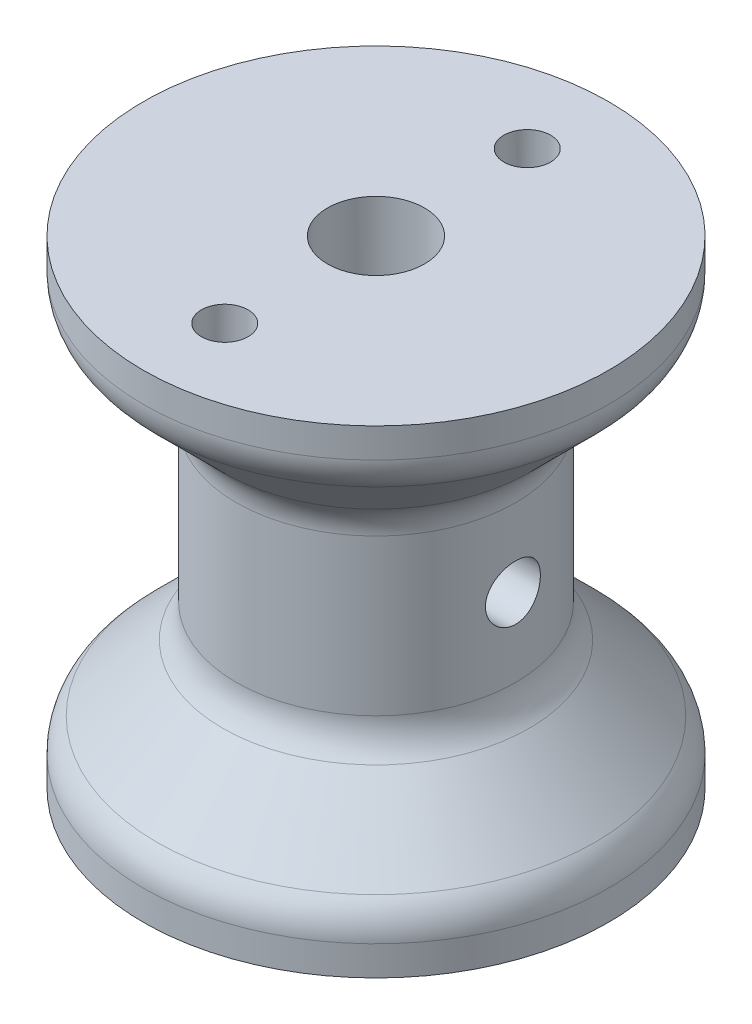
from build123d import *

# Parameters (mm, degrees)
SKETCH1_R                 = 12.7
BOSS_EXTRUDE1_DEPTH       = 36
F_5_0MM_DOWEL_HOLE1_D     = 5.3
BOSS_EXTRUDE2_START       = -4.953
BOSS_EXTRUDE2_DEPTH       = 2.286
CIRPATTERN3_COUNT         = 33
CIRPATTERN3_ANGLE         = 348.48
CIRPATTERN3_START         = -4.953
CIRPATTERN3_COPY_1_DEPTH  = 2.286
CIRPATTERN3_COPY_2_DEPTH  = 2.286
CIRPATTERN3_COPY_3_DEPTH  = 2.286
CIRPATTERN3_COPY_4_DEPTH  = 2.286
CIRPATTERN3_COPY_5_DEPTH  = 2.286
CIRPATTERN3_COPY_6_DEPTH  = 2.286
CIRPATTERN3_COPY_7_DEPTH  = 2.286
CIRPATTERN3_COPY_8_DEPTH  = 2.286
CIRPATTERN3_COPY_9_DEPTH  = 2.286
CIRPATTERN3_COPY_10_DEPTH = 2.286
CIRPATTERN3_COPY_11_DEPTH = 2.286
CIRPATTERN3_COPY_12_DEPTH = 2.286
CIRPATTERN3_COPY_13_DEPTH = 2.286
CIRPATTERN3_COPY_14_DEPTH = 2.286
CIRPATTERN3_COPY_15_DEPTH = 2.286
CIRPATTERN3_COPY_16_DEPTH = 2.286
CIRPATTERN3_COPY_17_DEPTH = 2.286
CIRPATTERN3_COPY_18_DEPTH = 2.286
CIRPATTERN3_COPY_19_DEPTH = 2.286
CIRPATTERN3_COPY_20_DEPTH = 2.286
CIRPATTERN3_COPY_21_DEPTH = 2.286
CIRPATTERN3_COPY_22_DEPTH = 2.286
CIRPATTERN3_COPY_23_DEPTH = 2.286
CIRPATTERN3_COPY_24_DEPTH = 2.286
CIRPATTERN3_COPY_25_DEPTH = 2.286
CIRPATTERN3_COPY_26_DEPTH = 2.286
CIRPATTERN3_COPY_27_DEPTH = 2.286
CIRPATTERN3_COPY_28_DEPTH = 2.286
CIRPATTERN3_COPY_29_DEPTH = 2.286
CIRPATTERN3_COPY_30_DEPTH = 2.286
CIRPATTERN3_COPY_31_DEPTH = 2.286
CIRPATTERN3_COPY_32_DEPTH = 2.286
SKETCH7_W                 = 5.08
SKETCH7_H                 = 20.76
CHAMFER1_SIZE             = 5.08
SKETCH10_W                = 1.5
SKETCH10_H                = 14.726283714
FILLET2_R                 = 1.27
M3X0_5_TAPPED_HOLE2_D     = 2.55
M3X0_5_TAPPED_HOLE2_DEPTH = 9.906
M3X0_5_TAPPED_HOLE2_TIP   = 1.06985203
M3X0_5_TAPPED_HOLE1_D     = 2.5
M3X0_5_TAPPED_HOLE1_DEPTH = 9.906
M3X0_5_TAPPED_HOLE1_TIP   = 1.048874539
INTERSECT1_OUTLINE_R      = 2.65
INTERSECT1_OUTLINE_R_2    = 1.25
INTERSECT1_DEPTH          = 4.953
INTERSECT1_START          = 31.047
INTERSECT1_2_OUTLINE_R    = 1.275
INTERSECT1_2_OUTLINE_R_2  = 2.65
INTERSECT1_2_DEPTH        = 4.953


with BuildPart() as part:
    # Sketch1 → Boss-Extrude1 (new body)
    with BuildSketch(Plane(origin=(0, 0, 0), x_dir=(1, 0, 0), z_dir=(0, 1, 0))):
        with Locations(Location((0, 0, 0), (0, 0, 270))):
            Circle(SKETCH1_R)
    extrude(amount=BOSS_EXTRUDE1_DEPTH)

    # Ø5.0mm Dowel Hole1 (through all)
    with Locations(Plane(origin=(0, 36, 0), x_dir=(1, 0, 0), z_dir=(0, 1, 0))):
        with Locations((0, 0)):
            Hole(F_5_0MM_DOWEL_HOLE1_D / 2)

    # Sketch4 → Boss-Extrude2 (add)
    with BuildSketch(Plane(origin=(0, 36, 0), x_dir=(1, 0, 0), z_dir=(0, 1, 0)).offset(BOSS_EXTRUDE2_START)):
        with BuildLine():
            Line((14.726283714, 0.381), (12.694283714, 0.381))
            ThreePointArc((12.694283714, 0.381), (12.698570848, 0.19052144), (12.7, 0))
            ThreePointArc((12.7, 0), (12.698570848, -0.19052144), (12.694283714, -0.381))
            Line((12.694283714, -0.381), (14.726283714, -0.381))
            Line((14.726283714, -0.381), (14.726283714, 0.381))
        make_face()
    boss_extrude2 = extrude(amount=BOSS_EXTRUDE2_DEPTH)

    # Mirror4: Boss-Extrude2 across plane
    add(boss_extrude2.mirror(Plane.ZX.offset(18)))

    # CirPattern3: Boss-Extrude2 ×33 about axis
    cirpattern3_axis = Axis((0, 0, 0), (0, 1, 0))
    for i in range(1, CIRPATTERN3_COUNT):
        add(boss_extrude2.rotate(cirpattern3_axis, i * CIRPATTERN3_ANGLE / (CIRPATTERN3_COUNT - 1)))

    # CirPattern3 copy 1 sketch → CirPattern3 copy 1 (add)
    with BuildSketch(Plane(origin=(0, 0, 0), x_dir=(0.9819917011209965, 0, -0.18892405598412157), z_dir=(0, -1, 0)).offset(CIRPATTERN3_START)):
        with BuildLine():
            Line((14.726283714, -0.381), (12.694283714, -0.381))
            ThreePointArc((12.694283714, -0.381), (12.698570848, -0.19052144), (12.7, 0))
            ThreePointArc((12.7, 0), (12.698570848, 0.19052144), (12.694283714, 0.381))
            Line((12.694283714, 0.381), (14.726283714, 0.381))
            Line((14.726283714, 0.381), (14.726283714, -0.381))
        make_face()
    extrude(amount=CIRPATTERN3_COPY_1_DEPTH)

    # CirPattern3 copy 2 sketch → CirPattern3 copy 2 (add)
    with BuildSketch(Plane(origin=(0, 0, 0), x_dir=(0.928615402141017, 0, -0.37104371023705185), z_dir=(0, -1, 0)).offset(CIRPATTERN3_START)):
        with BuildLine():
            Line((14.726283714, -0.381), (12.694283714, -0.381))
            ThreePointArc((12.694283714, -0.381), (12.698570848, -0.19052144), (12.7, 0))
            ThreePointArc((12.7, 0), (12.698570848, 0.19052144), (12.694283714, 0.381))
            Line((12.694283714, 0.381), (14.726283714, 0.381))
            Line((14.726283714, 0.381), (14.726283714, -0.381))
        make_face()
    extrude(amount=CIRPATTERN3_COPY_2_DEPTH)

    # CirPattern3 copy 3 sketch → CirPattern3 copy 3 (add)
    with BuildSketch(Plane(origin=(0, 0, 0), x_dir=(0.8417935357502346, 0, -0.5397996324277357), z_dir=(0, -1, 0)).offset(CIRPATTERN3_START)):
        with BuildLine():
            Line((14.726283714, -0.381), (12.694283714, -0.381))
            ThreePointArc((12.694283714, -0.381), (12.698570848, -0.19052144), (12.7, 0))
            ThreePointArc((12.7, 0), (12.698570848, 0.19052144), (12.694283714, 0.381))
            Line((12.694283714, 0.381), (14.726283714, 0.381))
            Line((14.726283714, 0.381), (14.726283714, -0.381))
        make_face()
    extrude(amount=CIRPATTERN3_COPY_3_DEPTH)

    # CirPattern3 copy 4 sketch → CirPattern3 copy 4 (add)
    with BuildSketch(Plane(origin=(0, 0, 0), x_dir=(0.7246531301870455, 0, -0.6891138083873497), z_dir=(0, -1, 0)).offset(CIRPATTERN3_START)):
        with BuildLine():
            Line((14.726283714, -0.381), (12.694283714, -0.381))
            ThreePointArc((12.694283714, -0.381), (12.698570848, -0.19052144), (12.7, 0))
            ThreePointArc((12.7, 0), (12.698570848, 0.19052144), (12.694283714, 0.381))
            Line((12.694283714, 0.381), (14.726283714, 0.381))
            Line((14.726283714, 0.381), (14.726283714, -0.381))
        make_face()
    extrude(amount=CIRPATTERN3_COPY_4_DEPTH)

    # CirPattern3 copy 5 sketch → CirPattern3 copy 5 (add)
    with BuildSketch(Plane(origin=(0, 0, 0), x_dir=(0.5814131843198288, 0, -0.8136084495007884), z_dir=(0, -1, 0)).offset(CIRPATTERN3_START)):
        with BuildLine():
            Line((14.726283714, -0.381), (12.694283714, -0.381))
            ThreePointArc((12.694283714, -0.381), (12.698570848, -0.19052144), (12.7, 0))
            ThreePointArc((12.7, 0), (12.698570848, 0.19052144), (12.694283714, 0.381))
            Line((12.694283714, 0.381), (14.726283714, 0.381))
            Line((14.726283714, 0.381), (14.726283714, -0.381))
        make_face()
    extrude(amount=CIRPATTERN3_COPY_5_DEPTH)

    # CirPattern3 copy 6 sketch → CirPattern3 copy 6 (add)
    with BuildSketch(Plane(origin=(0, 0, 0), x_dir=(0.417232713661763, 0, -0.9087996823560411), z_dir=(0, -1, 0)).offset(CIRPATTERN3_START)):
        with BuildLine():
            Line((14.726283714, -0.381), (12.694283714, -0.381))
            ThreePointArc((12.694283714, -0.381), (12.698570848, -0.19052144), (12.7, 0))
            ThreePointArc((12.7, 0), (12.698570848, 0.19052144), (12.694283714, 0.381))
            Line((12.694283714, 0.381), (14.726283714, 0.381))
            Line((14.726283714, 0.381), (14.726283714, -0.381))
        make_face()
    extrude(amount=CIRPATTERN3_COPY_6_DEPTH)

    # CirPattern3 copy 7 sketch → CirPattern3 copy 7 (add)
    with BuildSketch(Plane(origin=(0, 0, 0), x_dir=(0.2380249401842595, 0, -0.971259042609272), z_dir=(0, -1, 0)).offset(CIRPATTERN3_START)):
        with BuildLine():
            Line((14.726283714, -0.381), (12.694283714, -0.381))
            ThreePointArc((12.694283714, -0.381), (12.698570848, -0.19052144), (12.7, 0))
            ThreePointArc((12.7, 0), (12.698570848, 0.19052144), (12.694283714, 0.381))
            Line((12.694283714, 0.381), (14.726283714, 0.381))
            Line((14.726283714, 0.381), (14.726283714, -0.381))
        make_face()
    extrude(amount=CIRPATTERN3_COPY_7_DEPTH)

    # CirPattern3 copy 8 sketch → CirPattern3 copy 8 (add)
    with BuildSketch(Plane(origin=(0, 0, 0), x_dir=(0.05024431817976605, 0, -0.9987369566060177), z_dir=(0, -1, 0)).offset(CIRPATTERN3_START)):
        with BuildLine():
            Line((14.726283714, -0.381), (12.694283714, -0.381))
            ThreePointArc((12.694283714, -0.381), (12.698570848, -0.19052144), (12.7, 0))
            ThreePointArc((12.7, 0), (12.698570848, 0.19052144), (12.694283714, 0.381))
            Line((12.694283714, 0.381), (14.726283714, 0.381))
            Line((14.726283714, 0.381), (14.726283714, -0.381))
        make_face()
    extrude(amount=CIRPATTERN3_COPY_8_DEPTH)

    # CirPattern3 copy 9 sketch → CirPattern3 copy 9 (add)
    with BuildSketch(Plane(origin=(0, 0, 0), x_dir=(-0.13934593322223357, 0, -0.9902437633706282), z_dir=(0, -1, 0)).offset(CIRPATTERN3_START)):
        with BuildLine():
            Line((14.726283714, -0.381), (12.694283714, -0.381))
            ThreePointArc((12.694283714, -0.381), (12.698570848, -0.19052144), (12.7, 0))
            ThreePointArc((12.7, 0), (12.698570848, 0.19052144), (12.694283714, 0.381))
            Line((12.694283714, 0.381), (14.726283714, 0.381))
            Line((14.726283714, 0.381), (14.726283714, -0.381))
        make_face()
    extrude(amount=CIRPATTERN3_COPY_9_DEPTH)

    # CirPattern3 copy 10 sketch → CirPattern3 copy 10 (add)
    with BuildSketch(Plane(origin=(0, 0, 0), x_dir=(-0.3239174181981537, 0, -0.9460853588275439), z_dir=(0, -1, 0)).offset(CIRPATTERN3_START)):
        with BuildLine():
            Line((14.726283714, -0.381), (12.694283714, -0.381))
            ThreePointArc((12.694283714, -0.381), (12.698570848, -0.19052144), (12.7, 0))
            ThreePointArc((12.7, 0), (12.698570848, 0.19052144), (12.694283714, 0.381))
            Line((12.694283714, 0.381), (14.726283714, 0.381))
            Line((14.726283714, 0.381), (14.726283714, -0.381))
        make_face()
    extrude(amount=CIRPATTERN3_COPY_10_DEPTH)

    # CirPattern3 copy 11 sketch → CirPattern3 copy 11 (add)
    with BuildSketch(Plane(origin=(0, 0, 0), x_dir=(-0.4968224998160187, 0, -0.8678521784708281), z_dir=(0, -1, 0)).offset(CIRPATTERN3_START)):
        with BuildLine():
            Line((14.726283714, -0.381), (12.694283714, -0.381))
            ThreePointArc((12.694283714, -0.381), (12.698570848, -0.19052144), (12.7, 0))
            ThreePointArc((12.7, 0), (12.698570848, 0.19052144), (12.694283714, 0.381))
            Line((12.694283714, 0.381), (14.726283714, 0.381))
            Line((14.726283714, 0.381), (14.726283714, -0.381))
        make_face()
    extrude(amount=CIRPATTERN3_COPY_11_DEPTH)

    # CirPattern3 copy 12 sketch → CirPattern3 copy 12 (add)
    with BuildSketch(Plane(origin=(0, 0, 0), x_dir=(-0.6518337253008826, 0, -0.7583619152887185), z_dir=(0, -1, 0)).offset(CIRPATTERN3_START)):
        with BuildLine():
            Line((14.726283714, -0.381), (12.694283714, -0.381))
            ThreePointArc((12.694283714, -0.381), (12.698570848, -0.19052144), (12.7, 0))
            ThreePointArc((12.7, 0), (12.698570848, 0.19052144), (12.694283714, 0.381))
            Line((12.694283714, 0.381), (14.726283714, 0.381))
            Line((14.726283714, 0.381), (14.726283714, -0.381))
        make_face()
    extrude(amount=CIRPATTERN3_COPY_12_DEPTH)

    # CirPattern3 copy 13 sketch → CirPattern3 copy 13 (add)
    with BuildSketch(Plane(origin=(0, 0, 0), x_dir=(-0.7833681176964816, 0, -0.6215580360486632), z_dir=(0, -1, 0)).offset(CIRPATTERN3_START)):
        with BuildLine():
            Line((14.726283714, -0.381), (12.694283714, -0.381))
            ThreePointArc((12.694283714, -0.381), (12.698570848, -0.19052144), (12.7, 0))
            ThreePointArc((12.7, 0), (12.698570848, 0.19052144), (12.694283714, 0.381))
            Line((12.694283714, 0.381), (14.726283714, 0.381))
            Line((14.726283714, 0.381), (14.726283714, -0.381))
        make_face()
    extrude(amount=CIRPATTERN3_COPY_13_DEPTH)

    # CirPattern3 copy 14 sketch → CirPattern3 copy 14 (add)
    with BuildSketch(Plane(origin=(0, 0, 0), x_dir=(-0.8866882557005594, 0, -0.46236775104098626), z_dir=(0, -1, 0)).offset(CIRPATTERN3_START)):
        with BuildLine():
            Line((14.726283714, -0.381), (12.694283714, -0.381))
            ThreePointArc((12.694283714, -0.381), (12.698570848, -0.19052144), (12.7, 0))
            ThreePointArc((12.7, 0), (12.698570848, 0.19052144), (12.694283714, 0.381))
            Line((12.694283714, 0.381), (14.726283714, 0.381))
            Line((14.726283714, 0.381), (14.726283714, -0.381))
        make_face()
    extrude(amount=CIRPATTERN3_COPY_14_DEPTH)

    # CirPattern3 copy 15 sketch → CirPattern3 copy 15 (add)
    with BuildSketch(Plane(origin=(0, 0, 0), x_dir=(-0.9580728994623211, 0, -0.2865245527277917), z_dir=(0, -1, 0)).offset(CIRPATTERN3_START)):
        with BuildLine():
            Line((14.726283714, -0.381), (12.694283714, -0.381))
            ThreePointArc((12.694283714, -0.381), (12.698570848, -0.19052144), (12.7, 0))
            ThreePointArc((12.7, 0), (12.698570848, 0.19052144), (12.694283714, 0.381))
            Line((12.694283714, 0.381), (14.726283714, 0.381))
            Line((14.726283714, 0.381), (14.726283714, -0.381))
        make_face()
    extrude(amount=CIRPATTERN3_COPY_15_DEPTH)

    # CirPattern3 copy 16 sketch → CirPattern3 copy 16 (add)
    with BuildSketch(Plane(origin=(0, 0, 0), x_dir=(-0.9949510169813008, 0, -0.1003617148512079), z_dir=(0, -1, 0)).offset(CIRPATTERN3_START)):
        with BuildLine():
            Line((14.726283714, -0.381), (12.694283714, -0.381))
            ThreePointArc((12.694283714, -0.381), (12.698570848, -0.19052144), (12.7, 0))
            ThreePointArc((12.7, 0), (12.698570848, 0.19052144), (12.694283714, 0.381))
            Line((12.694283714, 0.381), (14.726283714, 0.381))
            Line((14.726283714, 0.381), (14.726283714, -0.381))
        make_face()
    extrude(amount=CIRPATTERN3_COPY_16_DEPTH)

    # CirPattern3 copy 17 sketch → CirPattern3 copy 17 (add)
    with BuildSketch(Plane(origin=(0, 0, 0), x_dir=(-0.9959943839327452, 0, 0.08941581053947567), z_dir=(0, -1, 0)).offset(CIRPATTERN3_START)):
        with BuildLine():
            Line((14.726283714, -0.381), (12.694283714, -0.381))
            ThreePointArc((12.694283714, -0.381), (12.698570848, -0.19052144), (12.7, 0))
            ThreePointArc((12.7, 0), (12.698570848, 0.19052144), (12.694283714, 0.381))
            Line((12.694283714, 0.381), (14.726283714, 0.381))
            Line((14.726283714, 0.381), (14.726283714, -0.381))
        make_face()
    extrude(amount=CIRPATTERN3_COPY_17_DEPTH)

    # CirPattern3 copy 18 sketch → CirPattern3 copy 18 (add)
    with BuildSketch(Plane(origin=(0, 0, 0), x_dir=(-0.9611654217888497, 0, 0.27597288264875364), z_dir=(0, -1, 0)).offset(CIRPATTERN3_START)):
        with BuildLine():
            Line((14.726283714, -0.381), (12.694283714, -0.381))
            ThreePointArc((12.694283714, -0.381), (12.698570848, -0.19052144), (12.7, 0))
            ThreePointArc((12.7, 0), (12.698570848, 0.19052144), (12.694283714, 0.381))
            Line((12.694283714, 0.381), (14.726283714, 0.381))
            Line((14.726283714, 0.381), (14.726283714, -0.381))
        make_face()
    extrude(amount=CIRPATTERN3_COPY_18_DEPTH)

    # CirPattern3 copy 19 sketch → CirPattern3 copy 19 (add)
    with BuildSketch(Plane(origin=(0, 0, 0), x_dir=(-0.8917185512694802, 0, 0.45259035045155294), z_dir=(0, -1, 0)).offset(CIRPATTERN3_START)):
        with BuildLine():
            Line((14.726283714, -0.381), (12.694283714, -0.381))
            ThreePointArc((12.694283714, -0.381), (12.698570848, -0.19052144), (12.7, 0))
            ThreePointArc((12.7, 0), (12.698570848, 0.19052144), (12.694283714, 0.381))
            Line((12.694283714, 0.381), (14.726283714, 0.381))
            Line((14.726283714, 0.381), (14.726283714, -0.381))
        make_face()
    extrude(amount=CIRPATTERN3_COPY_19_DEPTH)

    # CirPattern3 copy 20 sketch → CirPattern3 copy 20 (add)
    with BuildSketch(Plane(origin=(0, 0, 0), x_dir=(-0.7901550123756849, 0, 0.6129070536529836), z_dir=(0, -1, 0)).offset(CIRPATTERN3_START)):
        with BuildLine():
            Line((14.726283714, -0.381), (12.694283714, -0.381))
            ThreePointArc((12.694283714, -0.381), (12.698570848, -0.19052144), (12.7, 0))
            ThreePointArc((12.7, 0), (12.698570848, 0.19052144), (12.694283714, 0.381))
            Line((12.694283714, 0.381), (14.726283714, 0.381))
            Line((14.726283714, 0.381), (14.726283714, -0.381))
        make_face()
    extrude(amount=CIRPATTERN3_COPY_20_DEPTH)

    # CirPattern3 copy 21 sketch → CirPattern3 copy 21 (add)
    with BuildSketch(Plane(origin=(0, 0, 0), x_dir=(-0.6601327782346817, 0, 0.7511489300399492), z_dir=(0, -1, 0)).offset(CIRPATTERN3_START)):
        with BuildLine():
            Line((14.726283714, -0.381), (12.694283714, -0.381))
            ThreePointArc((12.694283714, -0.381), (12.698570848, -0.19052144), (12.7, 0))
            ThreePointArc((12.7, 0), (12.698570848, 0.19052144), (12.694283714, 0.381))
            Line((12.694283714, 0.381), (14.726283714, 0.381))
            Line((14.726283714, 0.381), (14.726283714, -0.381))
        make_face()
    extrude(amount=CIRPATTERN3_COPY_21_DEPTH)

    # CirPattern3 copy 22 sketch → CirPattern3 copy 22 (add)
    with BuildSketch(Plane(origin=(0, 0, 0), x_dir=(-0.5063348073531241, 0, 0.8623369775573089), z_dir=(0, -1, 0)).offset(CIRPATTERN3_START)):
        with BuildLine():
            Line((14.726283714, -0.381), (12.694283714, -0.381))
            ThreePointArc((12.694283714, -0.381), (12.698570848, -0.19052144), (12.7, 0))
            ThreePointArc((12.7, 0), (12.698570848, 0.19052144), (12.694283714, 0.381))
            Line((12.694283714, 0.381), (14.726283714, 0.381))
            Line((14.726283714, 0.381), (14.726283714, -0.381))
        make_face()
    extrude(amount=CIRPATTERN3_COPY_22_DEPTH)

    # CirPattern3 copy 23 sketch → CirPattern3 copy 23 (add)
    with BuildSketch(Plane(origin=(0, 0, 0), x_dir=(-0.334300379384251, 0, 0.9424665810221314), z_dir=(0, -1, 0)).offset(CIRPATTERN3_START)):
        with BuildLine():
            Line((14.726283714, -0.381), (12.694283714, -0.381))
            ThreePointArc((12.694283714, -0.381), (12.698570848, -0.19052144), (12.7, 0))
            ThreePointArc((12.7, 0), (12.698570848, 0.19052144), (12.694283714, 0.381))
            Line((12.694283714, 0.381), (14.726283714, 0.381))
            Line((14.726283714, 0.381), (14.726283714, -0.381))
        make_face()
    extrude(amount=CIRPATTERN3_COPY_23_DEPTH)

    # CirPattern3 copy 24 sketch → CirPattern3 copy 24 (add)
    with BuildSketch(Plane(origin=(0, 0, 0), x_dir=(-0.15022558912074707, 0, 0.9886517447379155), z_dir=(0, -1, 0)).offset(CIRPATTERN3_START)):
        with BuildLine():
            Line((14.726283714, -0.381), (12.694283714, -0.381))
            ThreePointArc((12.694283714, -0.381), (12.698570848, -0.19052144), (12.7, 0))
            ThreePointArc((12.7, 0), (12.698570848, 0.19052144), (12.694283714, 0.381))
            Line((12.694283714, 0.381), (14.726283714, 0.381))
            Line((14.726283714, 0.381), (14.726283714, -0.381))
        make_face()
    extrude(amount=CIRPATTERN3_COPY_24_DEPTH)

    # CirPattern3 copy 25 sketch → CirPattern3 copy 25 (add)
    with BuildSketch(Plane(origin=(0, 0, 0), x_dir=(0.039259815759079296, 0, 0.9992290362407226), z_dir=(0, -1, 0)).offset(CIRPATTERN3_START)):
        with BuildLine():
            Line((14.726283714, -0.381), (12.694283714, -0.381))
            ThreePointArc((12.694283714, -0.381), (12.698570848, -0.19052144), (12.7, 0))
            ThreePointArc((12.7, 0), (12.698570848, 0.19052144), (12.694283714, 0.381))
            Line((12.694283714, 0.381), (14.726283714, 0.381))
            Line((14.726283714, 0.381), (14.726283714, -0.381))
        make_face()
    extrude(amount=CIRPATTERN3_COPY_25_DEPTH)

    # CirPattern3 copy 26 sketch → CirPattern3 copy 26 (add)
    with BuildSketch(Plane(origin=(0, 0, 0), x_dir=(0.22733121564665745, 0, 0.9738174974771263), z_dir=(0, -1, 0)).offset(CIRPATTERN3_START)):
        with BuildLine():
            Line((14.726283714, -0.381), (12.694283714, -0.381))
            ThreePointArc((12.694283714, -0.381), (12.698570848, -0.19052144), (12.7, 0))
            ThreePointArc((12.7, 0), (12.698570848, 0.19052144), (12.694283714, 0.381))
            Line((12.694283714, 0.381), (14.726283714, 0.381))
            Line((14.726283714, 0.381), (14.726283714, -0.381))
        make_face()
    extrude(amount=CIRPATTERN3_COPY_26_DEPTH)

    # CirPattern3 copy 27 sketch → CirPattern3 copy 27 (add)
    with BuildSketch(Plane(origin=(0, 0, 0), x_dir=(0.4072149185824512, 0, 0.9133323656171874), z_dir=(0, -1, 0)).offset(CIRPATTERN3_START)):
        with BuildLine():
            Line((14.726283714, -0.381), (12.694283714, -0.381))
            ThreePointArc((12.694283714, -0.381), (12.698570848, -0.19052144), (12.7, 0))
            ThreePointArc((12.7, 0), (12.698570848, 0.19052144), (12.694283714, 0.381))
            Line((12.694283714, 0.381), (14.726283714, 0.381))
            Line((14.726283714, 0.381), (14.726283714, -0.381))
        make_face()
    extrude(amount=CIRPATTERN3_COPY_27_DEPTH)

    # CirPattern3 copy 28 sketch → CirPattern3 copy 28 (add)
    with BuildSketch(Plane(origin=(0, 0, 0), x_dir=(0.5724321255946011, 0, 0.8199521093254452), z_dir=(0, -1, 0)).offset(CIRPATTERN3_START)):
        with BuildLine():
            Line((14.726283714, -0.381), (12.694283714, -0.381))
            ThreePointArc((12.694283714, -0.381), (12.698570848, -0.19052144), (12.7, 0))
            ThreePointArc((12.7, 0), (12.698570848, 0.19052144), (12.694283714, 0.381))
            Line((12.694283714, 0.381), (14.726283714, 0.381))
            Line((14.726283714, 0.381), (14.726283714, -0.381))
        make_face()
    extrude(amount=CIRPATTERN3_COPY_28_DEPTH)

    # CirPattern3 copy 29 sketch → CirPattern3 copy 29 (add)
    with BuildSketch(Plane(origin=(0, 0, 0), x_dir=(0.7170322749954494, 0, 0.697039967731299), z_dir=(0, -1, 0)).offset(CIRPATTERN3_START)):
        with BuildLine():
            Line((14.726283714, -0.381), (12.694283714, -0.381))
            ThreePointArc((12.694283714, -0.381), (12.698570848, -0.19052144), (12.7, 0))
            ThreePointArc((12.7, 0), (12.698570848, 0.19052144), (12.694283714, 0.381))
            Line((12.694283714, 0.381), (14.726283714, 0.381))
            Line((14.726283714, 0.381), (14.726283714, -0.381))
        make_face()
    extrude(amount=CIRPATTERN3_COPY_29_DEPTH)

    # CirPattern3 copy 30 sketch → CirPattern3 copy 30 (add)
    with BuildSketch(Plane(origin=(0, 0, 0), x_dir=(0.8358073613682778, 0, 0.5490228179981202), z_dir=(0, -1, 0)).offset(CIRPATTERN3_START)):
        with BuildLine():
            Line((14.726283714, -0.381), (12.694283714, -0.381))
            ThreePointArc((12.694283714, -0.381), (12.698570848, -0.19052144), (12.7, 0))
            ThreePointArc((12.7, 0), (12.698570848, 0.19052144), (12.694283714, 0.381))
            Line((12.694283714, 0.381), (14.726283714, 0.381))
            Line((14.726283714, 0.381), (14.726283714, -0.381))
        make_face()
    extrude(amount=CIRPATTERN3_COPY_30_DEPTH)

    # CirPattern3 copy 31 sketch → CirPattern3 copy 31 (add)
    with BuildSketch(Plane(origin=(0, 0, 0), x_dir=(0.9244795102035234, 0, 0.3812317342691366), z_dir=(0, -1, 0)).offset(CIRPATTERN3_START)):
        with BuildLine():
            Line((14.726283714, -0.381), (12.694283714, -0.381))
            ThreePointArc((12.694283714, -0.381), (12.698570848, -0.19052144), (12.7, 0))
            ThreePointArc((12.7, 0), (12.698570848, 0.19052144), (12.694283714, 0.381))
            Line((12.694283714, 0.381), (14.726283714, 0.381))
            Line((14.726283714, 0.381), (14.726283714, -0.381))
        make_face()
    extrude(amount=CIRPATTERN3_COPY_31_DEPTH)

    # CirPattern3 copy 32 sketch → CirPattern3 copy 32 (add)
    with BuildSketch(Plane(origin=(0, 0, 0), x_dir=(0.9798550523842496, 0, 0.19970998051439326), z_dir=(0, -1, 0)).offset(CIRPATTERN3_START)):
        with BuildLine():
            Line((14.726283714, -0.381), (12.694283714, -0.381))
            ThreePointArc((12.694283714, -0.381), (12.698570848, -0.19052144), (12.7, 0))
            ThreePointArc((12.7, 0), (12.698570848, 0.19052144), (12.694283714, 0.381))
            Line((12.694283714, 0.381), (14.726283714, 0.381))
            Line((14.726283714, 0.381), (14.726283714, -0.381))
        make_face()
    extrude(amount=CIRPATTERN3_COPY_32_DEPTH)

    # Sketch7 → Cut-Revolve1 (revolve, cut)
    with BuildSketch(Plane(origin=(0, 0, 0), x_dir=(0, 0, -1), z_dir=(1, 0, 0)), mode=Mode.PRIVATE) as cut_revolve1_sk:
        with Locations((10.16, 18)):
            Rectangle(SKETCH7_W, SKETCH7_H)
    revolve(cut_revolve1_sk.sketch.rotate(Axis((0, 36, 0), (0, -1, 0)), 180), axis=Axis((0, 36, 0), (0, -1, 0)), mode=Mode.SUBTRACT)

    # Chamfer1
    chamfer1_edges = [part.edges().sort_by_distance(p)[0] for p in [
        (0, 28.38, -7.62),
        (0, 7.62, -7.62),
    ]]
    chamfer(chamfer1_edges, length=CHAMFER1_SIZE - 0.0001)  # a hair under: the kernel refuses the full size

    # Fillet1: read off the stored shape, not the designer's step
    # Fillet1 outline → Fillet1 (revolve, cut)
    with BuildSketch(Plane.XY):
        with BuildLine():
            Line((12.7, 27.636051224), (12.7, 29.432102448))
            ThreePointArc((12.7, 29.432102448), (12.506654013, 28.46008653), (11.956051224, 27.636051224))
            Line((11.956051224, 27.636051224), (12.7, 27.636051224))
        make_face()
        with BuildLine():
            Line((12.7, 8.363948776), (11.956051224, 8.363948776))
            ThreePointArc((11.956051224, 8.363948776), (12.506654013, 7.53991347), (12.7, 6.567897552))
            Line((12.7, 6.567897552), (12.7, 8.363948776))
        make_face()
    revolve(axis=Axis((0, 0, 0), (0, 1, 0)), mode=Mode.SUBTRACT)

    # Fillet1 2 outline → Fillet1 2 (revolve)
    with BuildSketch(Plane.XY):
        with BuildLine():
            ThreePointArc((7.62, 22.247897552), (7.813345987, 23.21991347), (8.363948776, 24.043948776))
            Line((8.363948776, 24.043948776), (7.62, 24.043948776))
            Line((7.62, 24.043948776), (7.62, 22.247897552))
        make_face()
        with BuildLine():
            ThreePointArc((8.363948776, 11.956051224), (7.813345987, 12.78008653), (7.62, 13.752102448))
            Line((7.62, 13.752102448), (7.62, 11.956051224))
            Line((7.62, 11.956051224), (8.363948776, 11.956051224))
        make_face()
    revolve(axis=Axis((0, 0, 0), (0, 1, 0)))

    # Sketch10 → Ø3.0mm Dowel Hole1 (revolve, cut)
    with BuildSketch(Plane.ZX.offset(18)):
        with Locations((0.75, 7.363141857)):
            Rectangle(SKETCH10_W, SKETCH10_H)
    revolve(axis=Axis((-6.35, 18, 0), (1, 0, 0)), mode=Mode.SUBTRACT)

    # Fillet2
    fillet2_edges = [part.edges().sort_by_distance(p)[0] for p in [
        (0, 0, -12.7),
        (0, 36, -12.7),
    ]]
    fillet(fillet2_edges, radius=FILLET2_R)

    # M3x0.5 Tapped Hole2
    with Locations(Plane(origin=(0, 36, 0), x_dir=(1, 0, 0), z_dir=(0, 1, 0))):
        with Locations((0, 8.255), (0, -8.255)):
            Hole(M3X0_5_TAPPED_HOLE2_D / 2, depth=M3X0_5_TAPPED_HOLE2_DEPTH)
            with Locations((0, 0, -(M3X0_5_TAPPED_HOLE2_DEPTH + M3X0_5_TAPPED_HOLE2_TIP / 2))):  # 100° drill point
                Cone(0, M3X0_5_TAPPED_HOLE2_D / 2, M3X0_5_TAPPED_HOLE2_TIP, mode=Mode.SUBTRACT)

    # M3x0.5 Tapped Hole1
    with Locations(Plane(origin=(0, 0, 0), x_dir=(-1, 0, 0), z_dir=(0, -1, 0))):
        with Locations((0, 8.255), (0, -8.255)):
            Hole(M3X0_5_TAPPED_HOLE1_D / 2, depth=M3X0_5_TAPPED_HOLE1_DEPTH)
            with Locations((0, 0, -(M3X0_5_TAPPED_HOLE1_DEPTH + M3X0_5_TAPPED_HOLE1_TIP / 2))):  # 100° drill point
                Cone(0, M3X0_5_TAPPED_HOLE1_D / 2, M3X0_5_TAPPED_HOLE1_TIP, mode=Mode.SUBTRACT)

    # Intersect1: read off the stored shape, not the designer's step
    # Intersect1 outline → Intersect1 (cut)
    with BuildSketch(Plane(origin=(0, 0, 0), x_dir=(1, 0, 0), z_dir=(0, 1, 0))):
        with BuildLine():
            ThreePointArc((12.514647536, -2.161850378), (12.635877916, -1.274593779), (12.694283714, -0.381))
            Line((12.694283714, -0.381), (14.726283714, -0.381))
            Line((14.726283714, -0.381), (14.726283714, 0.381))
            Line((14.726283714, 0.381), (12.694283714, 0.381))
            ThreePointArc((12.694283714, 0.381), (12.642694362, 1.205105499), (12.537661324, 2.024116729))
            Line((12.537661324, 2.024116729), (14.53306846, 2.408010411))
            Line((14.53306846, 2.408010411), (14.38910833, 3.156288087))
            Line((14.38910833, 3.156288087), (12.393701193, 2.772394405))
            ThreePointArc((12.393701193, 2.772394405), (12.187347525, 3.571912696), (11.929475029, 4.35633166))
            Line((11.929475029, 4.35633166), (13.816421526, 5.110292479))
            Line((13.816421526, 5.110292479), (13.533686219, 5.817897415))
            Line((13.533686219, 5.817897415), (11.646739722, 5.063936596))
            ThreePointArc((11.646739722, 5.063936596), (11.293053894, 5.810071751), (10.891629631, 6.531646345))
            Line((10.891629631, 6.531646345), (12.602154096, 7.628519198))
            Line((12.602154096, 7.628519198), (12.190826776, 8.269965873))
            Line((12.190826776, 8.269965873), (10.480302311, 7.17309302))
            ThreePointArc((10.480302311, 7.17309302), (9.992022883, 7.838971789), (9.461504789, 8.471713352))
            Line((9.461504789, 8.471713352), (10.93399995, 9.871992611))
            Line((10.93399995, 9.871992611), (10.408895228, 10.424178296))
            Line((10.408895228, 10.424178296), (8.936400068, 9.023899037))
            ThreePointArc((8.936400068, 9.023899037), (8.331113204, 9.585538732), (7.690608736, 10.106658066))
            Line((7.690608736, 10.106658066), (8.872040326, 11.759910436))
            Line((8.872040326, 11.759910436), (8.252070688, 12.202947282))
            Line((8.252070688, 12.202947282), (7.070639097, 10.549694913))
            ThreePointArc((7.070639097, 10.549694913), (6.370145171, 10.986867183), (5.642723121, 11.377595343))
            Line((5.642723121, 11.377595343), (6.490539995, 13.224276297))
            Line((6.490539995, 13.224276297), (5.798034637, 13.542207625))
            Line((5.798034637, 13.542207625), (4.950217763, 11.695526671))
            ThreePointArc((4.950217763, 11.695526671), (4.179746182, 11.992486058), (3.391605817, 12.238750344))
            Line((3.391605817, 12.238750344), (3.875272495, 14.212348719))
            Line((3.875272495, 14.212348719), (3.135173105, 14.393723723))
            Line((3.135173105, 14.393723723), (2.651506426, 12.420125348))
            ThreePointArc((2.651506426, 12.420125348), (1.838806956, 12.566176387), (1.01833441, 12.659107197))
            Line((1.01833441, 12.659107197), (1.120430865, 14.688540693))
            Line((1.120430865, 14.688540693), (0.359393304, 14.726826863))
            Line((0.359393304, 14.726826863), (0.25729685, 12.697393368))
            ThreePointArc((0.25729685, 12.697393368), (-0.56835984, 12.687275795), (-1.391613937, 12.623526078))
            Line((-1.391613937, 12.623526078), (-1.674764873, 14.635701406))
            Line((-1.674764873, 14.635701406), (-2.429330621, 14.529519804))
            Line((-2.429330621, 14.529519804), (-2.146179684, 12.517344477))
            ThreePointArc((-2.146179684, 12.517344477), (-2.955056249, 12.351422694), (-3.751441085, 12.133288498))
            Line((-3.751441085, 12.133288498), (-4.409641278, 14.055733948))
            Line((-4.409641278, 14.055733948), (-5.130558322, 13.808908875))
            Line((-5.130558322, 13.808908875), (-4.472358128, 11.886463426))
            ThreePointArc((-4.472358128, 11.886463426), (-5.235321585, 11.57071337), (-5.976154088, 11.206051147))
            Line((-5.976154088, 11.206051147), (-6.985697408, 12.969526774))
            Line((-6.985697408, 12.969526774), (-7.647000768, 12.590948029))
            Line((-7.647000768, 12.590948029), (-6.637457448, 10.827472402))
            ThreePointArc((-6.637457448, 10.827472402), (-7.32702845, 10.373266318), (-7.985626353, 9.87520996))
            Line((-7.985626353, 9.87520996), (-9.310152483, 11.416201371))
            Line((-9.310152483, 11.416201371), (-9.888024263, 10.919504073))
            Line((-9.888024263, 10.919504073), (-8.563498133, 9.378512661))
            ThreePointArc((-8.563498133, 9.378512661), (-9.154840678, 8.802209504), (-9.707483526, 8.188697307))
            Line((-9.707483526, 8.188697307), (-11.299287542, 9.451703236))
            Line((-11.299287542, 9.451703236), (-11.772914765, 8.85477673))
            Line((-11.772914765, 8.85477673), (-10.18111075, 7.591770801))
            ThreePointArc((-10.18111075, 7.591770801), (-10.652926692, 6.914127052), (-11.07971017, 6.207255637))
            Line((-11.07971017, 6.207255637), (-12.881460706, 7.146786907))
            Line((-12.881460706, 7.146786907), (-13.233784932, 6.471130456))
            Line((-13.233784932, 6.471130456), (-11.432034397, 5.531599186))
            ThreePointArc((-11.432034397, 5.531599186), (-11.767330531, 4.777021267), (-12.052883349, 4.002249738))
            Line((-12.052883349, 4.002249738), (-13.999687481, 4.584467629))
            Line((-13.999687481, 4.584467629), (-14.21801919, 3.85441608))
            Line((-14.21801919, 3.85441608), (-12.271215059, 3.272198189))
            ThreePointArc((-12.271215059, 3.272198189), (-12.457915159, 2.467863428), (-12.591952677, 1.65309642))
            Line((-12.591952677, 1.65309642), (-14.613693144, 1.857031424))
            Line((-14.613693144, 1.857031424), (-14.690168771, 1.098878749))
            Line((-14.690168771, 1.098878749), (-12.668428304, 0.894943745))
            ThreePointArc((-12.668428304, 0.894943745), (-12.699808068, 0.069821545), (-12.677502711, -0.755595807))
            Line((-12.677502711, -0.755595807), (-14.701363299, -0.937288734))
            Line((-14.701363299, -0.937288734), (-14.633228451, -1.696236455))
            Line((-14.633228451, -1.696236455), (-12.609367863, -1.514543528))
            ThreePointArc((-12.609367863, -1.514543528), (-12.484297098, -2.330735073), (-12.306452228, -3.137074044))
            Line((-12.306452228, -3.137074044), (-14.259540365, -3.697850941))
            Line((-14.259540365, -3.697850941), (-14.049249029, -4.430258993))
            Line((-14.049249029, -4.430258993), (-12.096160892, -3.869482095))
            ThreePointArc((-12.096160892, -3.869482095), (-11.819144221, -4.647346543), (-11.492165206, -5.405565547))
            Line((-11.492165206, -5.405565547), (-13.304137302, -6.325229139))
            Line((-13.304137302, -6.325229139), (-12.959263455, -7.004718675))
            Line((-12.959263455, -7.004718675), (-11.147291359, -6.085055083))
            ThreePointArc((-11.147291359, -6.085055083), (-10.728305981, -6.796576402), (-10.263969492, -7.479366969))
            Line((-10.263969492, -7.479366969), (-11.869564477, -8.724794102))
            Line((-11.869564477, -8.724794102), (-11.402529302, -9.326892222))
            Line((-11.402529302, -9.326892222), (-9.796934317, -8.081465089))
            ThreePointArc((-9.796934317, -8.081465089), (-9.251070659, -8.701016702), (-8.666100518, -9.283787041))
            Line((-8.666100518, -9.283787041), (-10.007490323, -10.810121666))
            Line((-10.007490323, -10.810121666), (-9.435114839, -11.313142843))
            Line((-9.435114839, -11.313142843), (-8.093725033, -9.786808218))
            ThreePointArc((-8.093725033, -9.786808218), (-7.440643248, -10.292075984), (-6.756108087, -10.753836688))
            Line((-6.756108087, -10.753836688), (-7.784980416, -12.506105427))
            Line((-7.784980416, -12.506105427), (-7.127879639, -12.89193255))
            Line((-7.127879639, -12.89193255), (-6.09900731, -11.139663811))
            ThreePointArc((-6.09900731, -11.139663811), (-5.362229181, -11.512449705), (-4.602783629, -11.836569725))
            Line((-4.602783629, -11.836569725), (-5.282082, -13.751661818))
            Line((-5.282082, -13.751661818), (-4.563922465, -14.006398707))
            Line((-4.563922465, -14.006398707), (-3.884624094, -12.091306615))
            ThreePointArc((-3.884624094, -12.091306615), (-3.090685862, -12.318184156), (-2.283682564, -12.492989792))
            Line((-2.283682564, -12.492989792), (-2.588940961, -14.501930137))
            Line((-2.588940961, -14.501930137), (-1.835588332, -14.616402036))
            Line((-1.835588332, -14.616402036), (-1.530329935, -12.607461691))
            ThreePointArc((-1.530329935, -12.607461691), (-0.707826555, -12.680259523), (0.117668977, -12.699454871))
            Line((0.117668977, -12.699454871), (0.197444923, -14.729888272))
            Line((0.197444923, -14.729888272), (0.958857448, -14.699972293))
            Line((0.958857448, -14.699972293), (0.879081503, -12.669538891))
            ThreePointArc((0.879081503, -12.669538891), (1.700526258, -12.585635083), (2.514782482, -12.448528791))
            Line((2.514782482, -12.448528791), (2.976719512, -14.427325946))
            Line((2.976719512, -14.427325946), (3.718768445, -14.25409956))
            Line((3.718768445, -14.25409956), (3.256831415, -12.275302405))
            ThreePointArc((3.256831415, -12.275302405), (4.0476319, -12.037718887), (4.821322078, -11.749249058))
            Line((4.821322078, -11.749249058), (5.648782792, -13.605140425))
            Line((5.648782792, -13.605140425), (6.344742055, -13.294842657))
            Line((6.344742055, -13.294842657), (5.51728134, -11.43895129))
            ThreePointArc((5.51728134, -11.43895129), (6.248955611, -11.056245012), (6.954214055, -10.626801347))
            Line((6.954214055, -10.626801347), (8.117396135, -12.292944033))
            Line((8.117396135, -12.292944033), (8.742199642, -11.856750754))
            Line((8.742199642, -11.856750754), (7.579017563, -10.190608067))
            ThreePointArc((7.579017563, -10.190608067), (8.225213203, -9.676562808), (8.836638903, -9.121612407))
            Line((8.836638903, -9.121612407), (10.293648486, -10.537997621))
            Line((10.293648486, -10.537997621), (10.824792941, -9.991619028))
            Line((10.824792941, -9.991619028), (9.367783358, -8.575233813))
            ThreePointArc((9.367783358, -8.575233813), (9.905226598, -7.948363733), (10.400798081, -7.287894022))
            Line((10.400798081, -7.287894022), (12.09915864, -8.403508388))
            Line((12.09915864, -8.403508388), (12.517514027, -7.766623178))
            Line((12.517514027, -7.766623178), (10.819153469, -6.651008812))
            ThreePointArc((10.819153469, -6.651008812), (11.228487432, -5.933891639), (11.590355899, -5.191690489))
            Line((11.590355899, -5.191690489), (13.468898264, -5.966353373))
            Line((13.468898264, -5.966353373), (13.759396845, -5.261899986))
            Line((13.759396845, -5.261899986), (11.880854481, -4.487237102))
            ThreePointArc((11.880854481, -4.487237102), (12.147336351, -3.705700956), (12.362468531, -2.908499928))
            Line((12.362468531, -2.908499928), (14.353533997, -3.314310608))
            Line((14.353533997, -3.314310608), (14.505713002, -2.567661059))
            Line((14.505713002, -2.567661059), (12.514647536, -2.161850378))
        make_face()
        Circle(INTERSECT1_OUTLINE_R, mode=Mode.SUBTRACT)
        with Locations((0, -8.255)):
            Circle(INTERSECT1_OUTLINE_R_2, mode=Mode.SUBTRACT)
        with Locations((0, 8.255)):
            Circle(INTERSECT1_OUTLINE_R_2, mode=Mode.SUBTRACT)
    extrude(amount=INTERSECT1_DEPTH, mode=Mode.SUBTRACT)

    # Intersect1 2 outline → Intersect1 2 (cut)
    with BuildSketch(Plane(origin=(0, 0, 0), x_dir=(1, 0, 0), z_dir=(0, 1, 0)).offset(INTERSECT1_START)):
        with BuildLine():
            ThreePointArc((12.514647536, -2.161850378), (12.635877916, -1.274593779), (12.694283714, -0.381))
            Line((12.694283714, -0.381), (14.726283714, -0.381))
            Line((14.726283714, -0.381), (14.726283714, 0.381))
            Line((14.726283714, 0.381), (12.694283714, 0.381))
            ThreePointArc((12.694283714, 0.381), (12.642694362, 1.205105499), (12.537661324, 2.024116729))
            Line((12.537661324, 2.024116729), (14.53306846, 2.408010411))
            Line((14.53306846, 2.408010411), (14.38910833, 3.156288087))
            Line((14.38910833, 3.156288087), (12.393701193, 2.772394405))
            ThreePointArc((12.393701193, 2.772394405), (12.187347525, 3.571912696), (11.929475029, 4.35633166))
            Line((11.929475029, 4.35633166), (13.816421526, 5.110292479))
            Line((13.816421526, 5.110292479), (13.533686219, 5.817897415))
            Line((13.533686219, 5.817897415), (11.646739722, 5.063936596))
            ThreePointArc((11.646739722, 5.063936596), (11.293053894, 5.810071751), (10.891629631, 6.531646345))
            Line((10.891629631, 6.531646345), (12.602154096, 7.628519198))
            Line((12.602154096, 7.628519198), (12.190826776, 8.269965873))
            Line((12.190826776, 8.269965873), (10.480302311, 7.17309302))
            ThreePointArc((10.480302311, 7.17309302), (9.992022883, 7.838971789), (9.461504789, 8.471713352))
            Line((9.461504789, 8.471713352), (10.93399995, 9.871992611))
            Line((10.93399995, 9.871992611), (10.408895228, 10.424178296))
            Line((10.408895228, 10.424178296), (8.936400068, 9.023899037))
            ThreePointArc((8.936400068, 9.023899037), (8.331113204, 9.585538732), (7.690608736, 10.106658066))
            Line((7.690608736, 10.106658066), (8.872040326, 11.759910436))
            Line((8.872040326, 11.759910436), (8.252070688, 12.202947282))
            Line((8.252070688, 12.202947282), (7.070639097, 10.549694913))
            ThreePointArc((7.070639097, 10.549694913), (6.370145171, 10.986867183), (5.642723121, 11.377595343))
            Line((5.642723121, 11.377595343), (6.490539995, 13.224276297))
            Line((6.490539995, 13.224276297), (5.798034637, 13.542207625))
            Line((5.798034637, 13.542207625), (4.950217763, 11.695526671))
            ThreePointArc((4.950217763, 11.695526671), (4.179746182, 11.992486058), (3.391605817, 12.238750344))
            Line((3.391605817, 12.238750344), (3.875272495, 14.212348719))
            Line((3.875272495, 14.212348719), (3.135173105, 14.393723723))
            Line((3.135173105, 14.393723723), (2.651506426, 12.420125348))
            ThreePointArc((2.651506426, 12.420125348), (1.838806956, 12.566176387), (1.01833441, 12.659107197))
            Line((1.01833441, 12.659107197), (1.120430865, 14.688540693))
            Line((1.120430865, 14.688540693), (0.359393304, 14.726826863))
            Line((0.359393304, 14.726826863), (0.25729685, 12.697393368))
            ThreePointArc((0.25729685, 12.697393368), (-0.56835984, 12.687275795), (-1.391613937, 12.623526078))
            Line((-1.391613937, 12.623526078), (-1.674764873, 14.635701406))
            Line((-1.674764873, 14.635701406), (-2.429330621, 14.529519804))
            Line((-2.429330621, 14.529519804), (-2.146179684, 12.517344477))
            ThreePointArc((-2.146179684, 12.517344477), (-2.955056249, 12.351422694), (-3.751441085, 12.133288498))
            Line((-3.751441085, 12.133288498), (-4.409641278, 14.055733948))
            Line((-4.409641278, 14.055733948), (-5.130558322, 13.808908875))
            Line((-5.130558322, 13.808908875), (-4.472358128, 11.886463426))
            ThreePointArc((-4.472358128, 11.886463426), (-5.235321585, 11.57071337), (-5.976154088, 11.206051147))
            Line((-5.976154088, 11.206051147), (-6.985697408, 12.969526774))
            Line((-6.985697408, 12.969526774), (-7.647000768, 12.590948029))
            Line((-7.647000768, 12.590948029), (-6.637457448, 10.827472402))
            ThreePointArc((-6.637457448, 10.827472402), (-7.32702845, 10.373266318), (-7.985626353, 9.87520996))
            Line((-7.985626353, 9.87520996), (-9.310152483, 11.416201371))
            Line((-9.310152483, 11.416201371), (-9.888024263, 10.919504073))
            Line((-9.888024263, 10.919504073), (-8.563498133, 9.378512661))
            ThreePointArc((-8.563498133, 9.378512661), (-9.154840678, 8.802209504), (-9.707483526, 8.188697307))
            Line((-9.707483526, 8.188697307), (-11.299287542, 9.451703236))
            Line((-11.299287542, 9.451703236), (-11.772914765, 8.85477673))
            Line((-11.772914765, 8.85477673), (-10.18111075, 7.591770801))
            ThreePointArc((-10.18111075, 7.591770801), (-10.652926692, 6.914127052), (-11.07971017, 6.207255637))
            Line((-11.07971017, 6.207255637), (-12.881460706, 7.146786907))
            Line((-12.881460706, 7.146786907), (-13.233784932, 6.471130456))
            Line((-13.233784932, 6.471130456), (-11.432034397, 5.531599186))
            ThreePointArc((-11.432034397, 5.531599186), (-11.767330531, 4.777021267), (-12.052883349, 4.002249738))
            Line((-12.052883349, 4.002249738), (-13.999687481, 4.584467629))
            Line((-13.999687481, 4.584467629), (-14.21801919, 3.85441608))
            Line((-14.21801919, 3.85441608), (-12.271215059, 3.272198189))
            ThreePointArc((-12.271215059, 3.272198189), (-12.457915159, 2.467863428), (-12.591952677, 1.65309642))
            Line((-12.591952677, 1.65309642), (-14.613693144, 1.857031424))
            Line((-14.613693144, 1.857031424), (-14.690168771, 1.098878749))
            Line((-14.690168771, 1.098878749), (-12.668428304, 0.894943745))
            ThreePointArc((-12.668428304, 0.894943745), (-12.699808068, 0.069821545), (-12.677502711, -0.755595807))
            Line((-12.677502711, -0.755595807), (-14.701363299, -0.937288734))
            Line((-14.701363299, -0.937288734), (-14.633228451, -1.696236455))
            Line((-14.633228451, -1.696236455), (-12.609367863, -1.514543528))
            ThreePointArc((-12.609367863, -1.514543528), (-12.484297098, -2.330735073), (-12.306452228, -3.137074044))
            Line((-12.306452228, -3.137074044), (-14.259540365, -3.697850941))
            Line((-14.259540365, -3.697850941), (-14.049249029, -4.430258993))
            Line((-14.049249029, -4.430258993), (-12.096160892, -3.869482095))
            ThreePointArc((-12.096160892, -3.869482095), (-11.819144221, -4.647346543), (-11.492165206, -5.405565547))
            Line((-11.492165206, -5.405565547), (-13.304137302, -6.325229139))
            Line((-13.304137302, -6.325229139), (-12.959263455, -7.004718675))
            Line((-12.959263455, -7.004718675), (-11.147291359, -6.085055083))
            ThreePointArc((-11.147291359, -6.085055083), (-10.728305981, -6.796576402), (-10.263969492, -7.479366969))
            Line((-10.263969492, -7.479366969), (-11.869564477, -8.724794102))
            Line((-11.869564477, -8.724794102), (-11.402529302, -9.326892222))
            Line((-11.402529302, -9.326892222), (-9.796934317, -8.081465089))
            ThreePointArc((-9.796934317, -8.081465089), (-9.251070659, -8.701016702), (-8.666100518, -9.283787041))
            Line((-8.666100518, -9.283787041), (-10.007490323, -10.810121666))
            Line((-10.007490323, -10.810121666), (-9.435114839, -11.313142843))
            Line((-9.435114839, -11.313142843), (-8.093725033, -9.786808218))
            ThreePointArc((-8.093725033, -9.786808218), (-7.440643248, -10.292075984), (-6.756108087, -10.753836688))
            Line((-6.756108087, -10.753836688), (-7.784980416, -12.506105427))
            Line((-7.784980416, -12.506105427), (-7.127879639, -12.89193255))
            Line((-7.127879639, -12.89193255), (-6.09900731, -11.139663811))
            ThreePointArc((-6.09900731, -11.139663811), (-5.362229181, -11.512449705), (-4.602783629, -11.836569725))
            Line((-4.602783629, -11.836569725), (-5.282082, -13.751661818))
            Line((-5.282082, -13.751661818), (-4.563922465, -14.006398707))
            Line((-4.563922465, -14.006398707), (-3.884624094, -12.091306615))
            ThreePointArc((-3.884624094, -12.091306615), (-3.090685862, -12.318184156), (-2.283682564, -12.492989792))
            Line((-2.283682564, -12.492989792), (-2.588940961, -14.501930137))
            Line((-2.588940961, -14.501930137), (-1.835588332, -14.616402036))
            Line((-1.835588332, -14.616402036), (-1.530329935, -12.607461691))
            ThreePointArc((-1.530329935, -12.607461691), (-0.707826555, -12.680259523), (0.117668977, -12.699454871))
            Line((0.117668977, -12.699454871), (0.197444923, -14.729888272))
            Line((0.197444923, -14.729888272), (0.958857448, -14.699972293))
            Line((0.958857448, -14.699972293), (0.879081503, -12.669538891))
            ThreePointArc((0.879081503, -12.669538891), (1.700526258, -12.585635083), (2.514782482, -12.448528791))
            Line((2.514782482, -12.448528791), (2.976719512, -14.427325946))
            Line((2.976719512, -14.427325946), (3.718768445, -14.25409956))
            Line((3.718768445, -14.25409956), (3.256831415, -12.275302405))
            ThreePointArc((3.256831415, -12.275302405), (4.0476319, -12.037718887), (4.821322078, -11.749249058))
            Line((4.821322078, -11.749249058), (5.648782792, -13.605140425))
            Line((5.648782792, -13.605140425), (6.344742055, -13.294842657))
            Line((6.344742055, -13.294842657), (5.51728134, -11.43895129))
            ThreePointArc((5.51728134, -11.43895129), (6.248955611, -11.056245012), (6.954214055, -10.626801347))
            Line((6.954214055, -10.626801347), (8.117396135, -12.292944033))
            Line((8.117396135, -12.292944033), (8.742199642, -11.856750754))
            Line((8.742199642, -11.856750754), (7.579017563, -10.190608067))
            ThreePointArc((7.579017563, -10.190608067), (8.225213203, -9.676562808), (8.836638903, -9.121612407))
            Line((8.836638903, -9.121612407), (10.293648486, -10.537997621))
            Line((10.293648486, -10.537997621), (10.824792941, -9.991619028))
            Line((10.824792941, -9.991619028), (9.367783358, -8.575233813))
            ThreePointArc((9.367783358, -8.575233813), (9.905226598, -7.948363733), (10.400798081, -7.287894022))
            Line((10.400798081, -7.287894022), (12.09915864, -8.403508388))
            Line((12.09915864, -8.403508388), (12.517514027, -7.766623178))
            Line((12.517514027, -7.766623178), (10.819153469, -6.651008812))
            ThreePointArc((10.819153469, -6.651008812), (11.228487432, -5.933891639), (11.590355899, -5.191690489))
            Line((11.590355899, -5.191690489), (13.468898264, -5.966353373))
            Line((13.468898264, -5.966353373), (13.759396845, -5.261899986))
            Line((13.759396845, -5.261899986), (11.880854481, -4.487237102))
            ThreePointArc((11.880854481, -4.487237102), (12.147336351, -3.705700956), (12.362468531, -2.908499928))
            Line((12.362468531, -2.908499928), (14.353533997, -3.314310608))
            Line((14.353533997, -3.314310608), (14.505713002, -2.567661059))
            Line((14.505713002, -2.567661059), (12.514647536, -2.161850378))
        make_face()
        with Locations((0, -8.255)):
            Circle(INTERSECT1_2_OUTLINE_R, mode=Mode.SUBTRACT)
        Circle(INTERSECT1_2_OUTLINE_R_2, mode=Mode.SUBTRACT)
        with Locations((0, 8.255)):
            Circle(INTERSECT1_2_OUTLINE_R, mode=Mode.SUBTRACT)
    extrude(amount=INTERSECT1_2_DEPTH, mode=Mode.SUBTRACT)


solid = part.part
